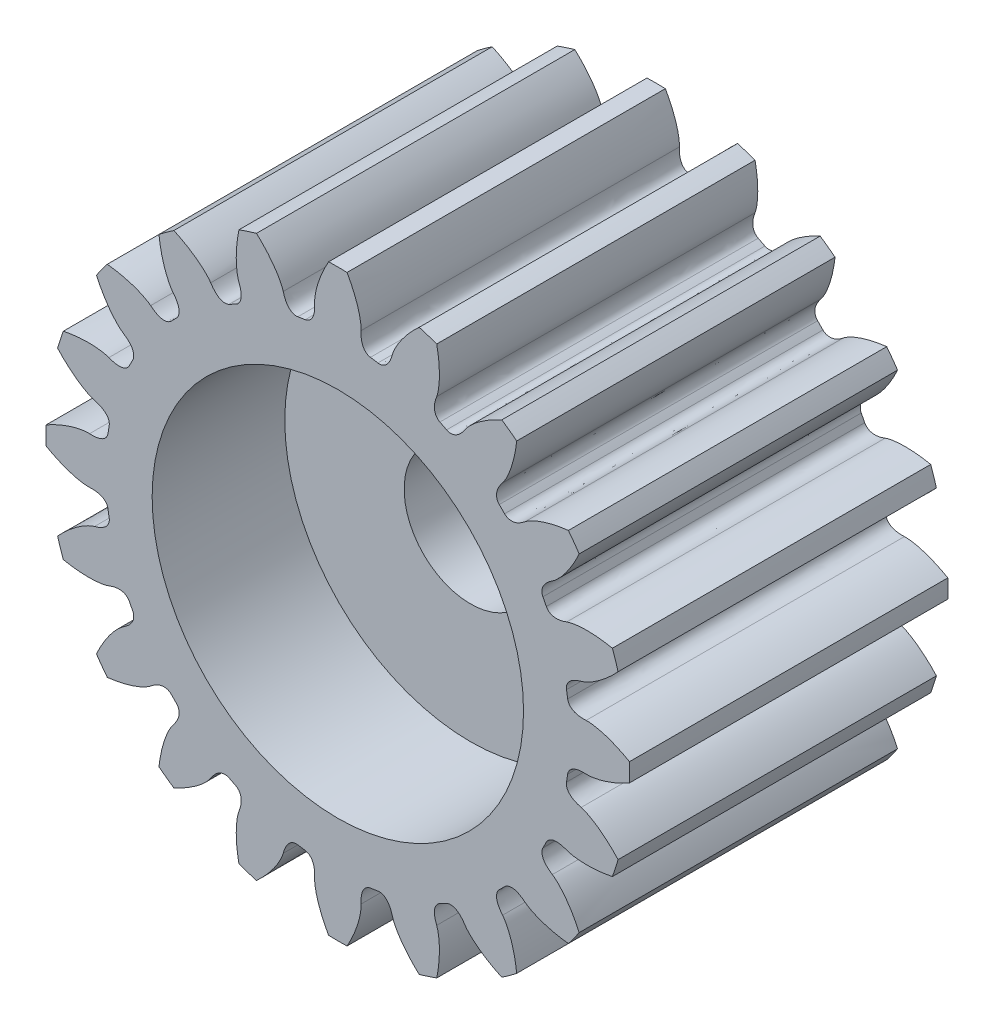
from build123d import *

# Parameters (mm, degrees)
SKETCH_1_R               = 8.75
EXTRUDE_1_DEPTH          = 12
EXTRUDE_START            = -12
EXTRUDE_3_DEPTH          = 12
PATTERN_CIRCULAR_1_COUNT = 20
SKETCH_3_R               = 7
CUT_EXTRUDE_1_DEPTH      = 5
CUT_EXTRUDE_START        = -5
SKETCH_4_R               = 7
CUT_EXTRUDE_2_DEPTH      = 5
SKETCH_5_R               = 2.5
CUT_EXTRUDE_3_DEPTH      = 10


# Read off the part's stored shape, not the designer's step: 보스-돌출3
with BuildPart() as part:
    # 스케치1 → 보스-돌출1 (new body)
    with BuildSketch(Plane.XY):
        Circle(SKETCH_1_R)
    extrude(amount=EXTRUDE_1_DEPTH)

    # 보스-돌출3 outline → 보스-돌출3 (add)
    with BuildSketch(Plane(origin=(0, 0, 0), x_dir=(-1, 0, 0), z_dir=(0, 0, -1)).offset(EXTRUDE_START)):
        with BuildLine():
            add(Edge.make_bspline(
                [(0.877055856, 9.359151175), (0.872179635, 9.285462301), (0.872049243, 9.177409008), (0.893327315, 9.03883085), (0.920017189, 8.943680783), (0.961409814, 8.852821598), (1.047583537, 8.734522692), (1.150113467, 8.675233933), (1.228449614, 8.663337206)],
                knots=[0, 0, 0, 0, 0.257550973, 0.374687481, 0.487633979, 0.600912128, 0.720919164, 0.993174308, 0.993174308, 0.993174308, 0.993174308], degree=3))
            add(Edge.make_bspline(
                [(0.877055856, 9.359151175), (0.879376071, 9.404260902), (0.875507166, 9.496939144), (0.856749496, 9.652552359), (0.819970312, 9.841323069), (0.756810218, 10.075054124), (0.617418965, 10.473872979), (0.467524211, 10.781941248), (0.347382117, 10.994513435)],
                knots=[0, 0, 0, 0, 0.077991928, 0.159989772, 0.270655666, 0.409989628, 0.577991667, 1, 1, 1, 1], degree=3))
            ThreePointArc((0.347382117, 10.994513435), (0, 11), (-0.347382117, 10.994513435))
            add(Edge.make_bspline(
                [(-0.877055856, 9.359151175), (-0.879376071, 9.404260902), (-0.875507166, 9.496939144), (-0.856749496, 9.652552359), (-0.819970312, 9.841323069), (-0.756810218, 10.075054124), (-0.617418965, 10.473872979), (-0.467524211, 10.781941248), (-0.347382117, 10.994513435)],
                knots=[0, 0, 0, 0, 0.077991928, 0.159989772, 0.270655666, 0.409989628, 0.577991667, 1, 1, 1, 1], degree=3))
            add(Edge.make_bspline(
                [(-0.877055856, 9.359151175), (-0.872179635, 9.285462301), (-0.872049243, 9.177409008), (-0.893327315, 9.03883085), (-0.920017189, 8.943680783), (-0.961409814, 8.852821598), (-1.047583537, 8.734522692), (-1.150113467, 8.675233933), (-1.228449614, 8.663337206)],
                knots=[0, 0, 0, 0, 0.257550973, 0.374687481, 0.487633979, 0.600912128, 0.720919164, 0.993174309, 0.993174309, 0.993174309, 0.993174309], degree=3))
            ThreePointArc((-1.228449614, 8.663337206), (0, 8.75), (1.228449614, 8.663337206))
        make_face()
    extrude_3 = extrude(amount=EXTRUDE_3_DEPTH)

    # 원형 패턴1: 보스-돌출3 ×20 about axis
    pattern_circular_1_axis = Axis((0, 0, 12), (0, 0, -1))
    for i in range(1, PATTERN_CIRCULAR_1_COUNT):
        add(extrude_3.rotate(pattern_circular_1_axis, i * 360 / PATTERN_CIRCULAR_1_COUNT))

    # 스케치3 → 컷-돌출1 (cut)
    with BuildSketch(Plane(origin=(0, 0, 0), x_dir=(-1, 0, 0), z_dir=(0, 0, -1))):
        Circle(SKETCH_3_R)
    extrude(amount=-CUT_EXTRUDE_1_DEPTH, mode=Mode.SUBTRACT)

    # 스케치4 → 컷-돌출2 (cut)
    with BuildSketch(Plane.XY.offset(12).offset(CUT_EXTRUDE_START)):
        with Locations(Location((0, 0, 0), (0, 0, 180))):
            Circle(SKETCH_4_R)
    extrude(amount=CUT_EXTRUDE_2_DEPTH, mode=Mode.SUBTRACT)

    # 스케치5 → 컷-돌출3 (cut)
    with BuildSketch(Plane.XY.offset(7)):
        Circle(SKETCH_5_R)
    extrude(amount=-CUT_EXTRUDE_3_DEPTH, mode=Mode.SUBTRACT)


solid = part.part
